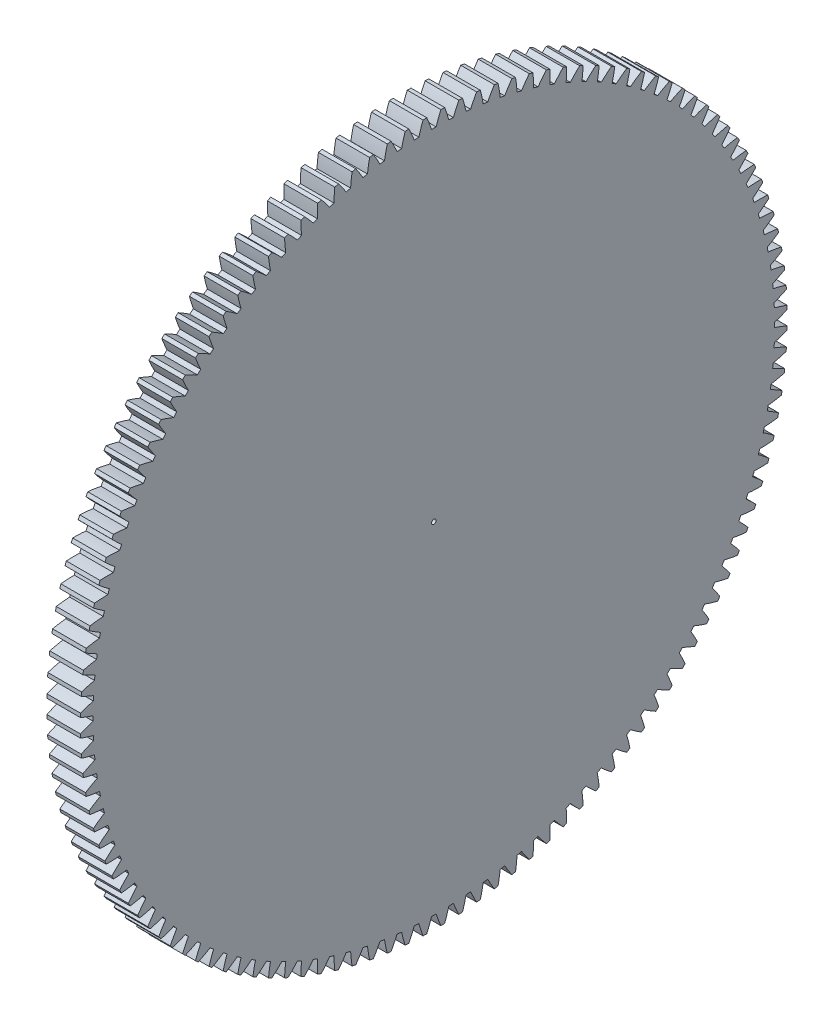
from build123d import *

# Parameters (mm, degrees)
BASPROSKE_W     = 6
BASPROSKE_H     = 63
TOOTHCUT_DEPTH  = 90.297256397
TEETHCUTS_COUNT = 124
TEETHCUTS_ANGLE = 357.096774194
BORSKE_R        = 0.4
BORE_DEPTH      = 50.0000508


with BuildPart() as part:
    # BasProSke → Base-Revolve (revolve)
    with BuildSketch(Plane(origin=(0, 0, 0), x_dir=(1, 0, 0), z_dir=(0, 1, 0))):
        with Locations((3, 31.5)):
            Rectangle(BASPROSKE_W, BASPROSKE_H)
    revolve(axis=Axis((-10, 0, 0), (1, 0, 0)))

    # TooCutSke → ToothCut (cut, through all)
    with BuildSketch(Plane(origin=(0, 0, 0), x_dir=(0, 0, -1), z_dir=(1, 0, 0))):
        with BuildLine():
            ThreePointArc((0.410069445, 60.747615954), (0, 60.749), (-0.410069445, 60.747615954))
            ThreePointArc((-0.410069445, 60.747615954), (-0.812309184, 61.890616344), (-1.269898411, 63.012605113))
            ThreePointArc((-1.269898411, 63.012605113), (0, 63.0254), (1.269898411, 63.012605113))
            ThreePointArc((1.269898411, 63.012605113), (0.812309184, 61.890616344), (0.410069445, 60.747615954))
        make_face()
    toothcut = extrude(amount=TOOTHCUT_DEPTH, mode=Mode.SUBTRACT)

    # TeethCuts: ToothCut ×124 about axis
    teethcuts_axis = Axis((-10, 0, 0), (1, 0, 0))
    for i in range(1, TEETHCUTS_COUNT):
        add(toothcut.rotate(teethcuts_axis, i * TEETHCUTS_ANGLE / (TEETHCUTS_COUNT - 1)), mode=Mode.SUBTRACT)

    # BorSke → Bore (cut, symmetric)
    with BuildSketch(Plane(origin=(0, 0, 0), x_dir=(0, 0, -1), z_dir=(1, 0, 0))):
        Circle(BORSKE_R)
    extrude(amount=BORE_DEPTH, both=True, mode=Mode.SUBTRACT)


solid = part.part
